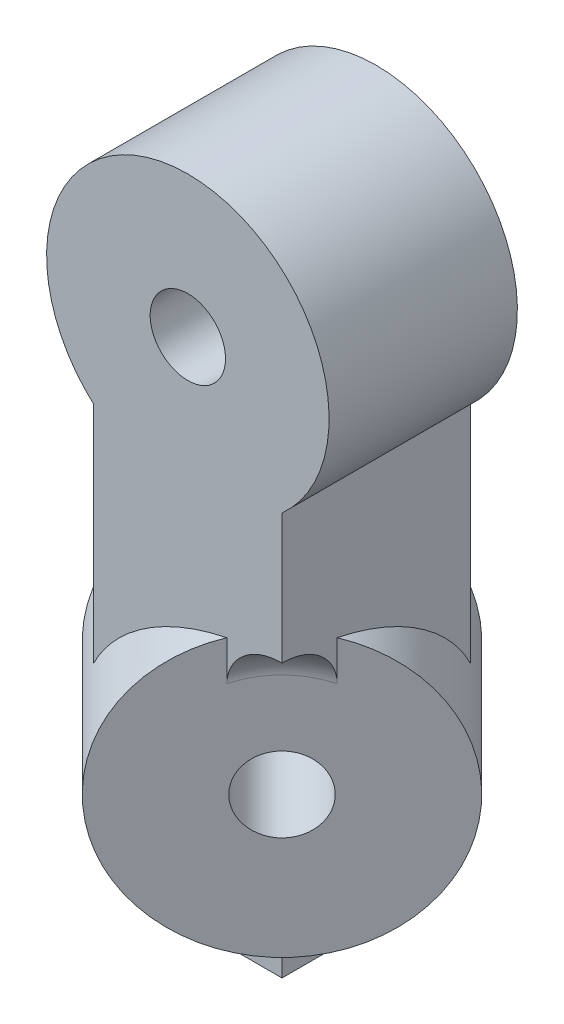
from build123d import *

# Parameters (mm, degrees)
SKETCH1_R               = 2
BOSS_EXTRUDE1_DEPTH     = 10
SKETCH6_R               = 7.5
BOSS_EXTRUDE3_DEPTH     = 5
CUT_EXTRUDE4_DEPTH      = 26.013853674
CUT_EXTRUDE4_DEPTH_BACK = 26.013853674
SKETCH7_R               = 2
SKETCH10_R              = 7.5
CUT_EXTRUDE7_DEPTH      = 9
SKETCH11_W              = 4
SKETCH11_H              = 4
BOSS_EXTRUDE4_DEPTH     = 2.5
FILLET1_R               = 2
SKETCH12_R              = 0.5
CUT_EXTRUDE8_DEPTH      = 10


with BuildPart() as part:
    # Sketch1 → Boss-Extrude1 (new body)
    with BuildSketch(Plane.XY):
        with BuildLine():
            Line((5.026455026, -10.023549892), (-4.973544974, -10.023549892))
            Line((-4.973544974, -10.023549892), (-4.973544974, 4.386280164))
            ThreePointArc((-4.973544974, 4.386280164), (0.026455026, 17.476450108), (5.026455026, 4.386280164))
            Line((5.026455026, 4.386280164), (5.026455026, -10.023549892))
        make_face()
        with Locations((0.026455026, 9.976450108)):
            Circle(SKETCH1_R, mode=Mode.SUBTRACT)
    extrude(amount=BOSS_EXTRUDE1_DEPTH)

    # Sketch6 → Boss-Extrude3 (add, symmetric)
    with BuildSketch(Plane(origin=(2.513227513, 0, 2.513227513), x_dir=(-0.7071067811865477, 0, 0.7071067811865475), z_dir=(-0.7071067811865475, 0, -0.7071067811865477))):
        with Locations((3.516827377, -10.023549892)):
            Circle(SKETCH6_R)
    extrude(amount=BOSS_EXTRUDE3_DEPTH, both=True)

    # Sketch7 → Cut-Extrude4 (cut, two sides: drawn at the far end of the back side and taken through both)
    with BuildSketch(Plane(origin=(-1.022306393, 0, -1.022306393), x_dir=(-0.7071067811865476, 0, 0.7071067811865476), z_dir=(-0.7071067811865476, 0, -0.7071067811865476)).offset(-CUT_EXTRUDE4_DEPTH_BACK)):
        with Locations((3.516827377, -10.023549892)):
            Circle(SKETCH7_R)
    extrude(amount=CUT_EXTRUDE4_DEPTH + CUT_EXTRUDE4_DEPTH_BACK, mode=Mode.SUBTRACT)

    # Sketch10 → Cut-Extrude7 (cut)
    with BuildSketch(Plane(origin=(6.048761419, 0, 6.048761419), x_dir=(0.7071067811865476, 0, -0.7071067811865476), z_dir=(0.7071067811865476, 0, 0.7071067811865476))):
        with Locations((-3.516827377, -10.023549892)):
            Circle(SKETCH10_R)
    cut_extrude7 = extrude(amount=CUT_EXTRUDE7_DEPTH, mode=Mode.SUBTRACT)

    # Mirror1: Cut-Extrude7 across plane
    add(cut_extrude7.mirror(Plane(origin=(2.513227513, 0, 2.513227513), x_dir=(-0.7071067811865478, 0, 0.7071067811865472), z_dir=(-0.7071067811865475, 0, -0.7071067811865477))), mode=Mode.SUBTRACT)

    # Sketch11 → Boss-Extrude4 (add, symmetric)
    with BuildSketch(Plane(origin=(0, -17.5, 0), x_dir=(1, 0, 0), z_dir=(0, 1, 0))):
        with Locations((0.026455026, -5)):
            Rectangle(SKETCH11_W, SKETCH11_H)
    extrude(amount=BOSS_EXTRUDE4_DEPTH, both=True)

    # Fillet1
    # the kernel refuses this fillet: 2 mm, written as the material it adds along each edge
    with BuildSketch(Plane(origin=(3.561988932, -10.023549892, 8.535533906), x_dir=(0.5737197168089216, 0.5845437306903406, -0.5737197168089216), z_dir=(0.4133348358712229, -0.8113622045120283, -0.4133348358712229))) as fillet1_piece_1_section:
        with BuildLine():
            CenterArc((7.5 - FILLET1_R, FILLET1_R), FILLET1_R, 270, 90)
            Line((7.5 - FILLET1_R, 0), (7.5, 0))
            Line((7.5, 0), (7.5, FILLET1_R))
        make_face()
    fillet1_piece_1 = revolve(axis=Axis((3.561988932, -10.023549892, 8.535533906), (0.7071067811865476, 0, 0.7071067811865476)), revolution_arc=108.458473571, mode=Mode.PRIVATE)
    fillet1_piece_1 = split(fillet1_piece_1, bisect_by=Plane(origin=(5.026455026, -3.097280079, 8.789305728), z_dir=(-1, 0, 0)), keep=Keep.TOP, mode=Mode.PRIVATE)
    fillet1_piece_1 = split(fillet1_piece_1, bisect_by=Plane(origin=(3.815760609, -3.097280079, 10), z_dir=(0, 0, -1)), keep=Keep.TOP, mode=Mode.PRIVATE)
    add(fillet1_piece_1)
    with BuildSketch(Plane(origin=(-3.509078879, -10.023549892, 1.464466094), x_dir=(0.5737197168089216, 0.584543730690341, -0.5737197168089213), z_dir=(0.4133348358712232, -0.8113622045120281, -0.4133348358712231))) as fillet1_piece_2_section:
        with BuildLine():
            CenterArc((7.5 - FILLET1_R, -FILLET1_R), FILLET1_R, 0, 90)
            Line((7.5 - FILLET1_R, 0), (7.5, 0))
            Line((7.5, 0), (7.5, -FILLET1_R))
        make_face()
    fillet1_piece_2 = revolve(axis=Axis((-3.509078879, -10.023549892, 1.464466094), (0.7071067811865475, 0, 0.7071067811865477)), revolution_arc=108.458473571, mode=Mode.PRIVATE)
    fillet1_piece_2 = split(fillet1_piece_2, bisect_by=Plane(origin=(-3.762850661, -3.097280076, 0), z_dir=(0, 0, 1)), keep=Keep.TOP, mode=Mode.PRIVATE)
    fillet1_piece_2 = split(fillet1_piece_2, bisect_by=Plane(origin=(-4.973544974, -3.097280076, 1.21069445), z_dir=(1, 0, 0)), keep=Keep.TOP, mode=Mode.PRIVATE)
    add(fillet1_piece_2)

    # Sketch12 → Cut-Extrude8 (cut)
    with BuildSketch(Plane(origin=(0, 0, 3), x_dir=(-1, 0, 0), z_dir=(0, 0, -1))):
        with Locations((-0.026455026, -18)):
            Circle(SKETCH12_R)
    extrude(amount=-CUT_EXTRUDE8_DEPTH, mode=Mode.SUBTRACT)


solid = part.part
